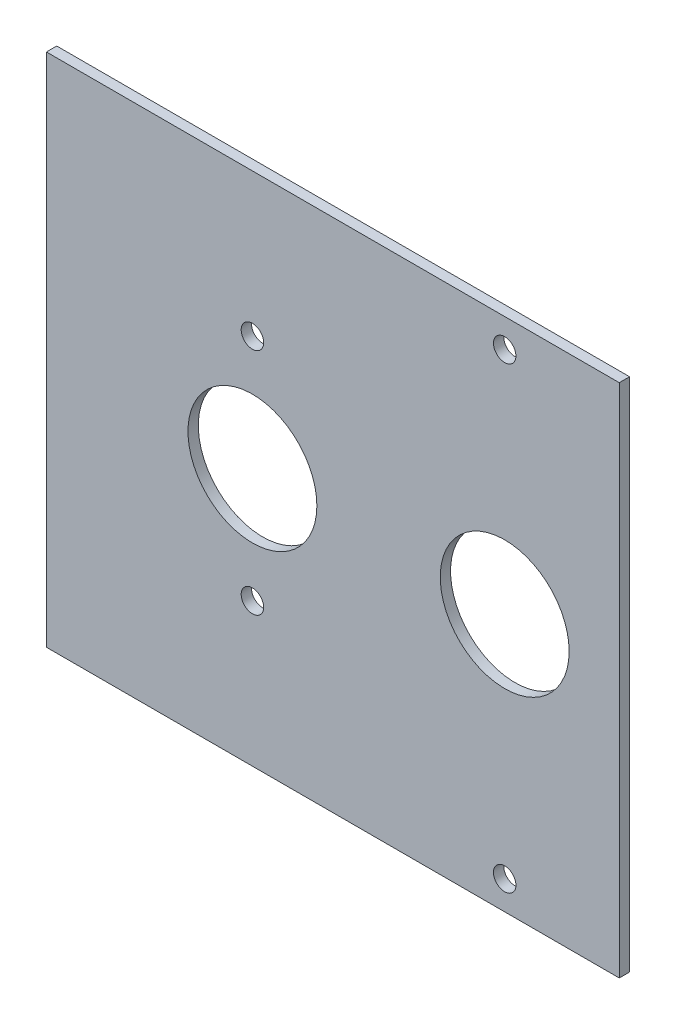
from build123d import *

# Parameters (mm, degrees)
SKETCH1_W           = 127
SKETCH1_H           = 114.3
SKETCH1_R           = 2.4892
SKETCH1_R_2         = 14.2875
BOSS_EXTRUDE1_DEPTH = 1.143


with BuildPart() as part:
    # Sketch1 → Boss-Extrude1 (new, symmetric)
    with BuildSketch(Plane.XY):
        with Locations((63.5, 57.15)):
            Rectangle(SKETCH1_W, SKETCH1_H)
        with Locations((45.6692, 82.55)):
            Circle(SKETCH1_R, mode=Mode.SUBTRACT)
        with Locations((45.6692, 57.15)):
            Circle(SKETCH1_R_2, mode=Mode.SUBTRACT)
        with Locations((45.6692, 31.75)):
            Circle(SKETCH1_R, mode=Mode.SUBTRACT)
        with Locations((101.6, 107.95)):
            Circle(SKETCH1_R, mode=Mode.SUBTRACT)
        with Locations((101.6, 57.15)):
            Circle(SKETCH1_R_2, mode=Mode.SUBTRACT)
        with Locations((101.6, 6.35)):
            Circle(SKETCH1_R, mode=Mode.SUBTRACT)
    extrude(amount=BOSS_EXTRUDE1_DEPTH, both=True)


solid = part.part
